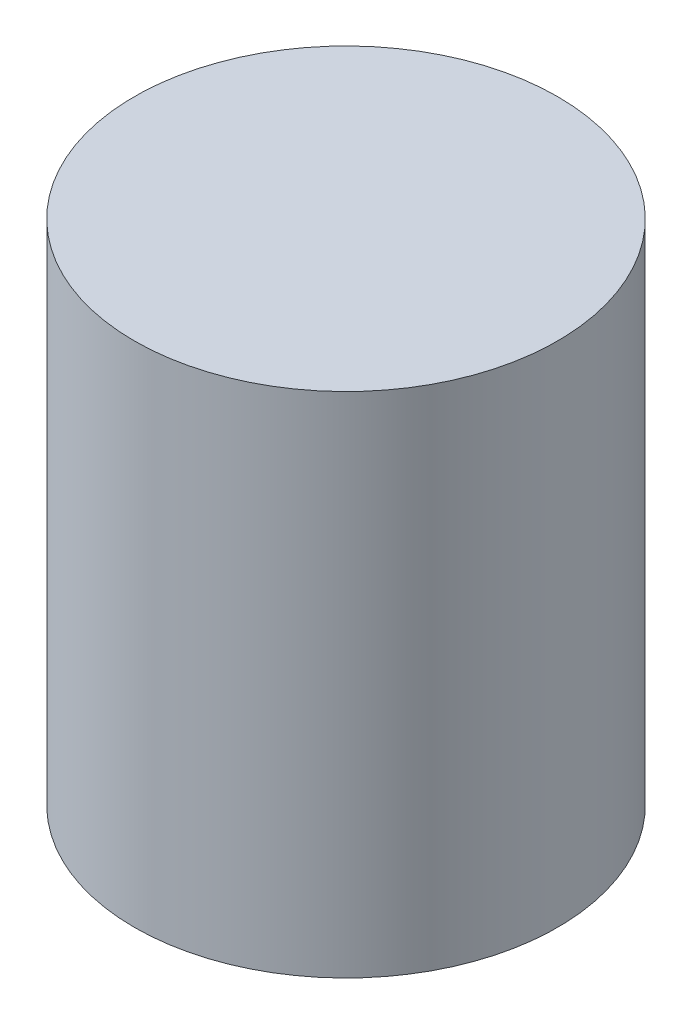
from build123d import *

# Parameters (mm, degrees)
SKETCH1_R           = 10
BOSS_EXTRUDE1_DEPTH = 12
SCALE1_SCALE        = 0.75


with BuildPart() as part:
    # Sketch1 → Boss-Extrude1 (new, symmetric)
    with BuildSketch(Plane(origin=(0, 0, 0), x_dir=(1, 0, 0), z_dir=(0, 1, 0))):
        Circle(SKETCH1_R)
    extrude(amount=BOSS_EXTRUDE1_DEPTH, both=True)


with BuildPart() as part_1:
    # Scale1: scaled about (0, 0, 0)
    add(part.part.scale(SCALE1_SCALE))


solid = part_1.part
